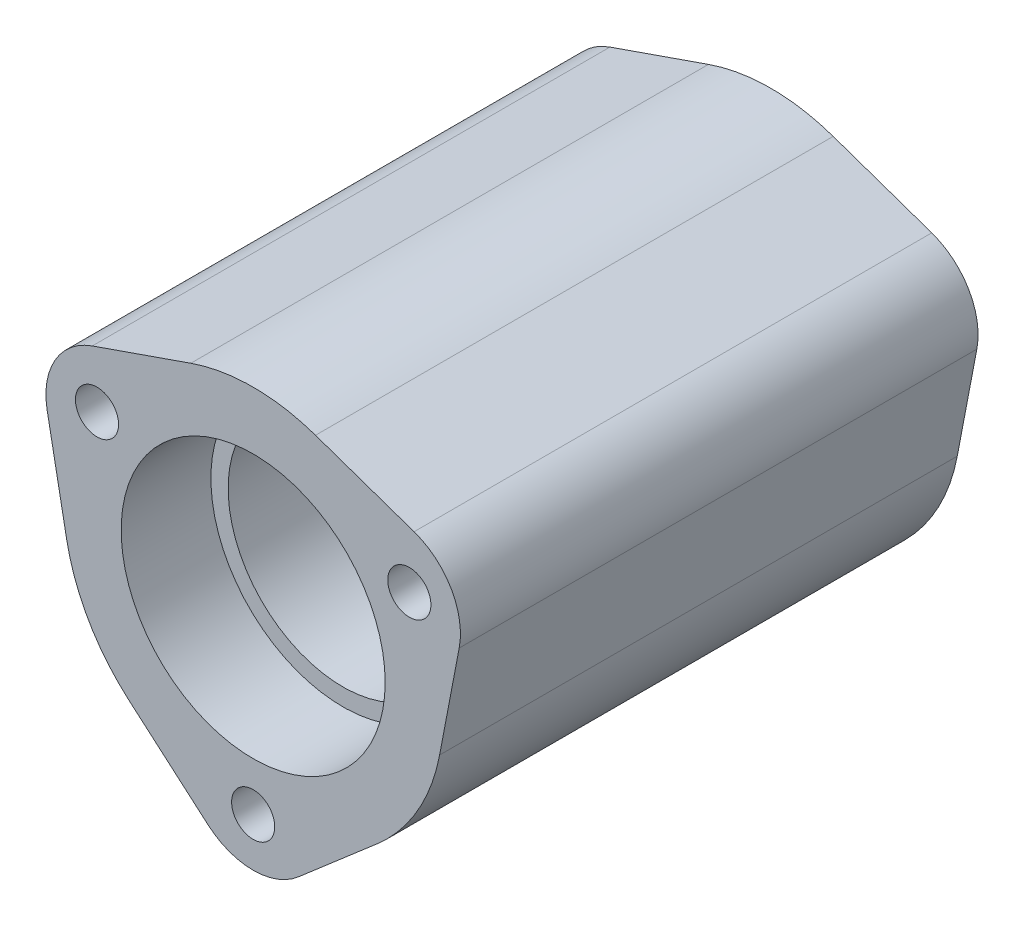
from build123d import *

# Parameters (mm, degrees)
EXTRUDE_765_DEPTH      = 15
EXTRUDE_765_DEPTH_BACK = 15
SKETCH_2_R             = 7.65
CUT_EXTRUDE_1103_DEPTH = 5.2
SKETCH_3_R             = 6.65
CUT_EXTRUDE_1241_DEPTH = 31.57548454
SKETCH_4_R             = 1.25
CUT_EXTRUDE_1712_DEPTH = 35.925925254


with BuildPart() as part:
    # Эскиз1 → Extrude 765 (new, two sides: drawn at the far end of the back side and taken through both)
    with BuildSketch(Plane.XY.offset(-EXTRUDE_765_DEPTH_BACK)):
        with BuildLine():
            Line((-9.32482414, 8.402984872), (-3.613745176, 10.389458398))
            ThreePointArc((-3.613745176, 10.389458398), (0, 11), (3.613745176, 10.389458398))
            Line((3.613745176, 10.389458398), (9.32482414, 8.402984872))
            ThreePointArc((9.32482414, 8.402984872), (11.4748366, 6.625), (11.939610437, 3.874042155))
            Line((11.939610437, 3.874042155), (10.804407492, -2.065134074))
            ThreePointArc((10.804407492, -2.065134074), (9.526279442, -5.5), (7.190662316, -8.324324324))
            Line((7.190662316, -8.324324324), (2.614786297, -12.277027027))
            ThreePointArc((2.614786297, -12.277027027), (0, -13.25), (-2.614786297, -12.277027027))
            Line((-2.614786297, -12.277027027), (-7.190662316, -8.324324324))
            ThreePointArc((-7.190662316, -8.324324324), (-9.526279442, -5.5), (-10.804407492, -2.065134074))
            Line((-10.804407492, -2.065134074), (-11.939610437, 3.874042155))
            ThreePointArc((-11.939610437, 3.874042155), (-11.4748366, 6.625), (-9.32482414, 8.402984872))
        make_face()
    extrude(amount=EXTRUDE_765_DEPTH + EXTRUDE_765_DEPTH_BACK)

    # Эскиз2 → Cut-Extrude 1103 (cut)
    with BuildSketch(Plane.XY.offset(15)):
        Circle(SKETCH_2_R)
    cut_extrude_1103 = extrude(amount=-CUT_EXTRUDE_1103_DEPTH, mode=Mode.SUBTRACT)

    # Mirror 1145: Cut-Extrude 1103 across plane
    add(cut_extrude_1103.mirror(Plane.XY), mode=Mode.SUBTRACT)

    # Эскиз3 → Cut-Extrude 1241 (cut, through all)
    with BuildSketch(Plane.XY.offset(9.8)):
        Circle(SKETCH_3_R)
    extrude(amount=-CUT_EXTRUDE_1241_DEPTH, mode=Mode.SUBTRACT)

    # Эскиз4 → Cut-Extrude 1712 (cut, through all)
    with BuildSketch(Plane.XY.offset(15)):
        with Locations((-9.04996547, 5.225)):
            Circle(SKETCH_4_R)
        with Locations((0, -10.45)):
            Circle(SKETCH_4_R)
        with Locations((9.04996547, 5.225)):
            Circle(SKETCH_4_R)
    extrude(amount=-CUT_EXTRUDE_1712_DEPTH, mode=Mode.SUBTRACT)


solid = part.part
